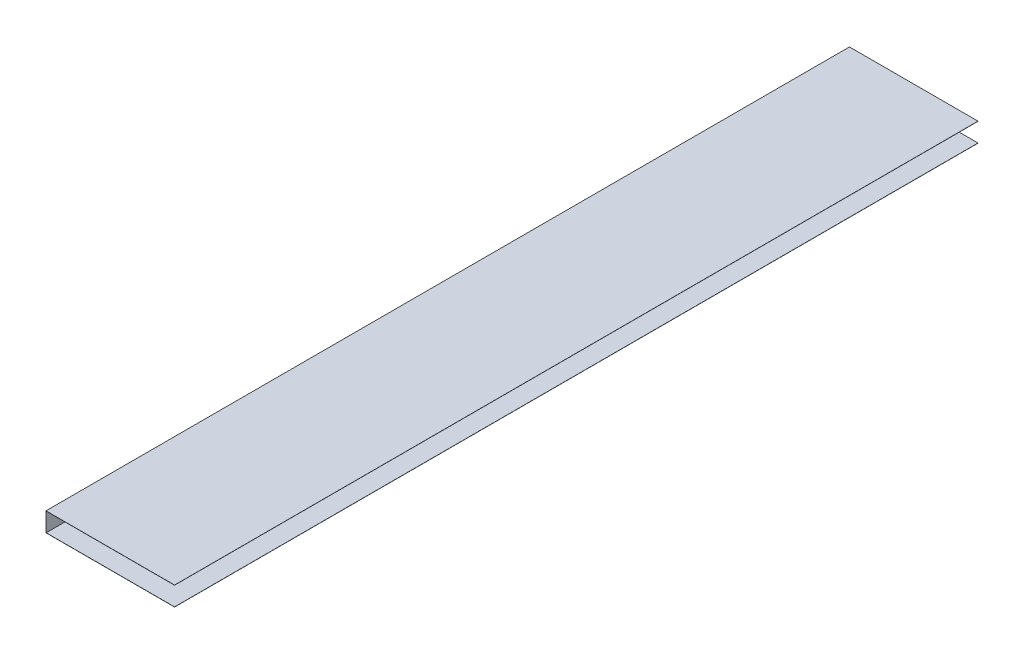
from build123d import *

# Parameters (mm, degrees)
BOSS_EXTRUDE1_DEPTH = 925


with BuildPart() as part:
    # Sketch1 → Boss-Extrude1 (new body)
    with BuildSketch(Plane.XY):
        Polygon((0, 0), (148, 0), (148, -0.2), (0.2, -0.2), (0.2, -21.8), (148, -21.8), (148, -22), (0, -22), align=None)
    extrude(amount=BOSS_EXTRUDE1_DEPTH)


solid = part.part
